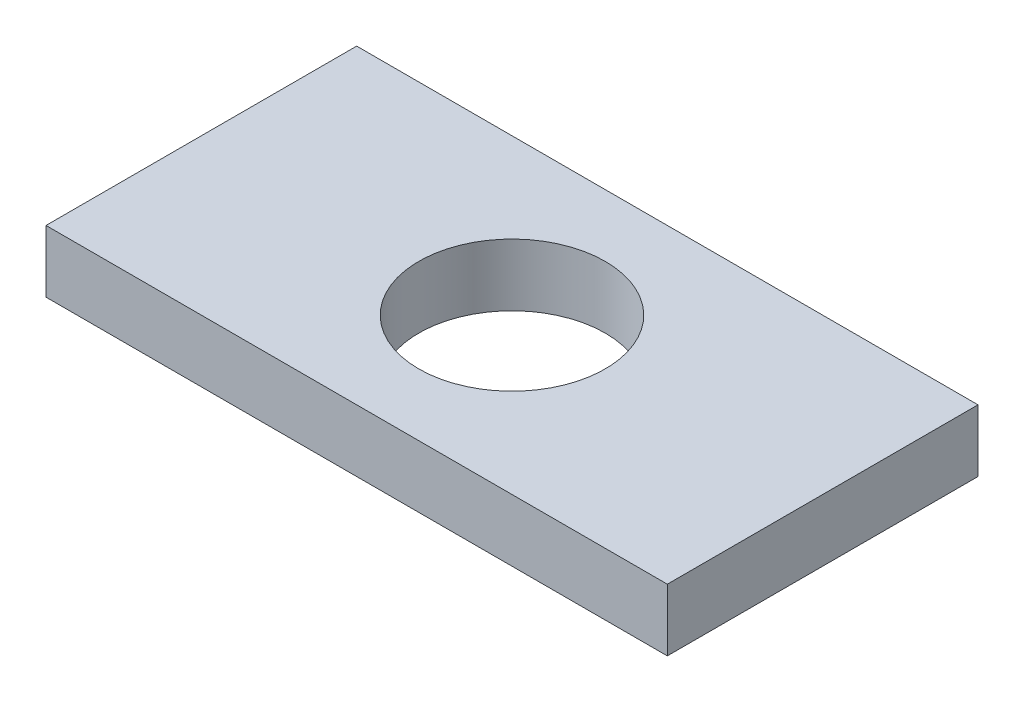
from build123d import *

# Parameters (mm, degrees)
SKETCH_1_W          = 40
SKETCH_1_H          = 20
EXTRUDE_1_DEPTH     = 4
SKETCH_2_R          = 6
CUT_EXTRUDE_1_DEPTH = 45.899888641


with BuildPart() as part:
    # Эскиз1 → Бобышка-Вытянуть1 (new body)
    with BuildSketch(Plane(origin=(0, 0, 0), x_dir=(1, 0, 0), z_dir=(0, 1, 0))):
        with Locations((20, 10)):
            Rectangle(SKETCH_1_W, SKETCH_1_H)
    extrude(amount=EXTRUDE_1_DEPTH)

    # Эскиз2 → Вырез-Вытянуть1 (cut, through all)
    with BuildSketch(Plane(origin=(0, 4, 0), x_dir=(1, 0, 0), z_dir=(0, 1, 0))):
        with Locations((20, 10)):
            Circle(SKETCH_2_R)
    extrude(amount=-CUT_EXTRUDE_1_DEPTH, mode=Mode.SUBTRACT)


solid = part.part
